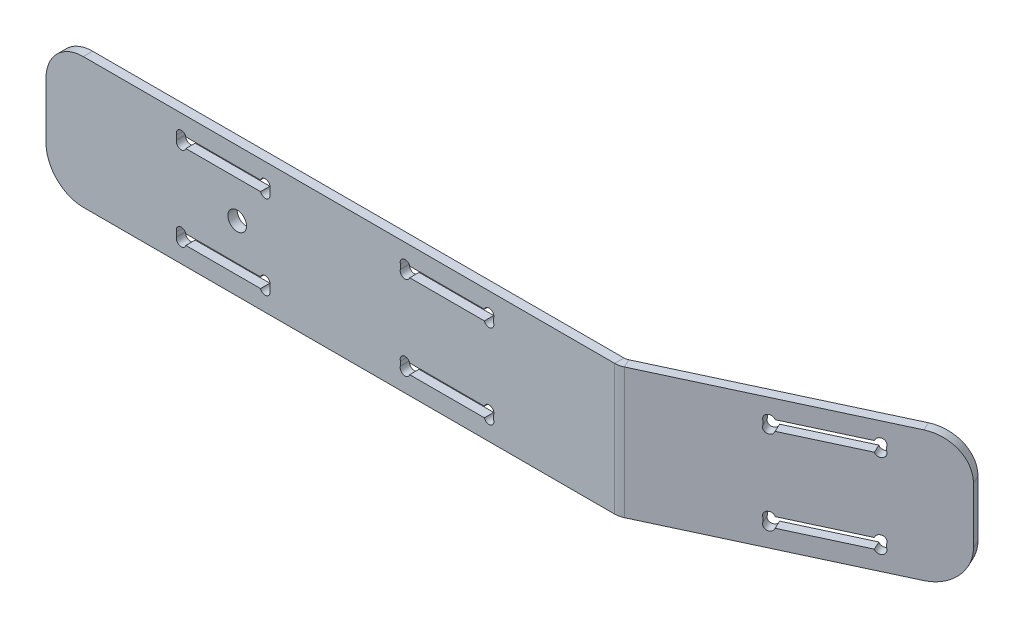
from build123d import *

# Parameters (mm, degrees)
BASE_FLANGE1_DEPTH = 44.45
SKETCH6_W          = 31.75
SKETCH6_H          = 3.429
CUT_EXTRUDE1_DEPTH = 284.468887342
SKETCH7_W          = 31.75
SKETCH7_H          = 3.429
CUT_EXTRUDE2_DEPTH = 272.141941158
FILLET1_R          = 12.7
CUT_EXTRUDE3_DEPTH = 284.468887342
CUT_EXTRUDE4_DEPTH = 272.141941158
SKETCH10_R         = 3.175
CUT_EXTRUDE5_DEPTH = 284.468887342


# Sheet-metal steps are written as plain solids
with BuildPart() as part:
    # Sketch1 → Base-Flange1 (new body)
    with BuildSketch(Plane(origin=(0, 0, 0), x_dir=(1, 0, 0), z_dir=(0, 1, 0))):
        with BuildLine():
            Line((0, 0), (193.606119446, 0))
            ThreePointArc((193.606119446, 0), (194.29331522, 0.075260177), (194.947932427, 0.297472776))
            Line((194.947932427, 0.297472776), (276.015713671, 38.1))
            Line((276.015713671, 38.1), (277.357526652, 35.222472776))
            Line((277.357526652, 35.222472776), (196.289745408, -2.580054448))
            ThreePointArc((196.289745408, -2.580054448), (194.980510995, -3.024479645), (193.606119446, -3.175))
            Line((193.606119446, -3.175), (0, -3.175))
            Line((0, -3.175), (0, 0))
        make_face()
    extrude(amount=BASE_FLANGE1_DEPTH)

    # Sketch6 → Cut-Extrude1 (cut, through all)
    with BuildSketch(Plane(origin=(0, 0, 0), x_dir=(-1, 0, 0), z_dir=(0, 0, -1))):
        with Locations((-136.525, 7.9375)):
            Rectangle(SKETCH6_W, SKETCH6_H)
        with Locations((-60.325, 36.5125)):
            Rectangle(SKETCH6_W, SKETCH6_H)
        with Locations((-136.525, 36.5125)):
            Rectangle(SKETCH6_W, SKETCH6_H)
        with Locations((-60.325, 7.9375)):
            Rectangle(SKETCH6_W, SKETCH6_H)
    extrude(amount=-CUT_EXTRUDE1_DEPTH, mode=Mode.SUBTRACT)

    # Sketch7 → Cut-Extrude2 (cut, through all)
    with BuildSketch(Plane(origin=(34.704969781, 0, 74.425047871), x_dir=(-0.9063077870366493, 0, 0.42261826174070083), z_dir=(-0.4226182617407009, 0, -0.9063077870366494))):
        with Locations((-228.156946417, 36.5125)):
            Rectangle(SKETCH7_W, SKETCH7_H)
        with Locations((-228.156946417, 7.9375)):
            Rectangle(SKETCH7_W, SKETCH7_H)
    extrude(amount=-CUT_EXTRUDE2_DEPTH, mode=Mode.SUBTRACT)

    # Fillet1
    fillet1_edges = [part.edges().sort_by_distance(p)[0] for p in [
        (0, 44.45, 1.5875),
        (0, 0, 1.5875),
        (276.686620162, 44.45, -36.661236388),
        (276.686620162, 0, -36.661236388),
    ]]
    fillet(fillet1_edges, radius=FILLET1_R)

    # Sketch8 → Cut-Extrude3 (cut, through all)
    with BuildSketch(Plane(origin=(0, 0, 0), x_dir=(-1, 0, 0), z_dir=(0, 0, -1))):
        with BuildLine():
            ThreePointArc((-44.938784585, 36.5125), (-46.030818439, 39.40175), (-47.122852293, 36.5125))
            ThreePointArc((-47.122852293, 36.5125), (-46.030818439, 33.62325), (-44.938784585, 36.5125))
        make_face()
        with BuildLine():
            ThreePointArc((-75.711215415, 36.5125), (-74.619181561, 33.62325), (-73.527147707, 36.5125))
            ThreePointArc((-73.527147707, 36.5125), (-74.619181561, 39.40175), (-75.711215415, 36.5125))
        make_face()
        with BuildLine():
            ThreePointArc((-121.138784585, 36.5125), (-122.230818439, 39.40175), (-123.322852293, 36.5125))
            ThreePointArc((-123.322852293, 36.5125), (-122.230818439, 33.62325), (-121.138784585, 36.5125))
        make_face()
        with BuildLine():
            ThreePointArc((-151.911215415, 36.5125), (-150.819181561, 33.62325), (-149.727147707, 36.5125))
            ThreePointArc((-149.727147707, 36.5125), (-150.819181561, 39.40175), (-151.911215415, 36.5125))
        make_face()
        with BuildLine():
            ThreePointArc((-151.911215415, 7.9375), (-150.819181561, 5.04825), (-149.727147707, 7.9375))
            ThreePointArc((-149.727147707, 7.9375), (-150.819181561, 10.82675), (-151.911215415, 7.9375))
        make_face()
        with BuildLine():
            ThreePointArc((-121.138784585, 7.9375), (-122.230818439, 10.82675), (-123.322852293, 7.9375))
            ThreePointArc((-123.322852293, 7.9375), (-122.230818439, 5.04825), (-121.138784585, 7.9375))
        make_face()
        with BuildLine():
            ThreePointArc((-75.711215415, 7.9375), (-74.619181561, 5.04825), (-73.527147707, 7.9375))
            ThreePointArc((-73.527147707, 7.9375), (-74.619181561, 10.82675), (-75.711215415, 7.9375))
        make_face()
        with BuildLine():
            ThreePointArc((-44.938784585, 7.9375), (-46.030818439, 10.82675), (-47.122852293, 7.9375))
            ThreePointArc((-47.122852293, 7.9375), (-46.030818439, 5.04825), (-44.938784585, 7.9375))
        make_face()
    extrude(amount=-CUT_EXTRUDE3_DEPTH, mode=Mode.SUBTRACT)

    # Sketch9 → Cut-Extrude4 (cut, through all)
    with BuildSketch(Plane(origin=(34.704969781, 0, 74.425047871), x_dir=(-0.9063077870366492, 0, 0.42261826174070116), z_dir=(-0.42261826174070116, 0, -0.9063077870366492))):
        with BuildLine():
            ThreePointArc((-214.95479871, 36.5125), (-213.862764856, 33.62325), (-212.770731003, 36.5125))
            ThreePointArc((-212.770731003, 36.5125), (-213.862764856, 39.40175), (-214.95479871, 36.5125))
        make_face()
        with BuildLine():
            ThreePointArc((-241.359094124, 36.5125), (-242.451127978, 39.40175), (-243.543161832, 36.5125))
            ThreePointArc((-243.543161832, 36.5125), (-242.451127978, 33.62325), (-241.359094124, 36.5125))
        make_face()
        with BuildLine():
            ThreePointArc((-241.359094124, 7.9375), (-242.451127978, 10.82675), (-243.543161832, 7.9375))
            ThreePointArc((-243.543161832, 7.9375), (-242.451127978, 5.04825), (-241.359094124, 7.9375))
        make_face()
        with BuildLine():
            ThreePointArc((-214.95479871, 7.9375), (-213.862764856, 5.04825), (-212.770731003, 7.9375))
            ThreePointArc((-212.770731003, 7.9375), (-213.862764856, 10.82675), (-214.95479871, 7.9375))
        make_face()
    extrude(amount=-CUT_EXTRUDE4_DEPTH, mode=Mode.SUBTRACT)

    # Sketch10 → Cut-Extrude5 (cut, through all)
    with BuildSketch(Plane(origin=(0, 0, 0), x_dir=(-1, 0, 0), z_dir=(0, 0, -1))):
        with Locations((-65.0875, 22.225)):
            Circle(SKETCH10_R)
    extrude(amount=-CUT_EXTRUDE5_DEPTH, mode=Mode.SUBTRACT)


solid = part.part
